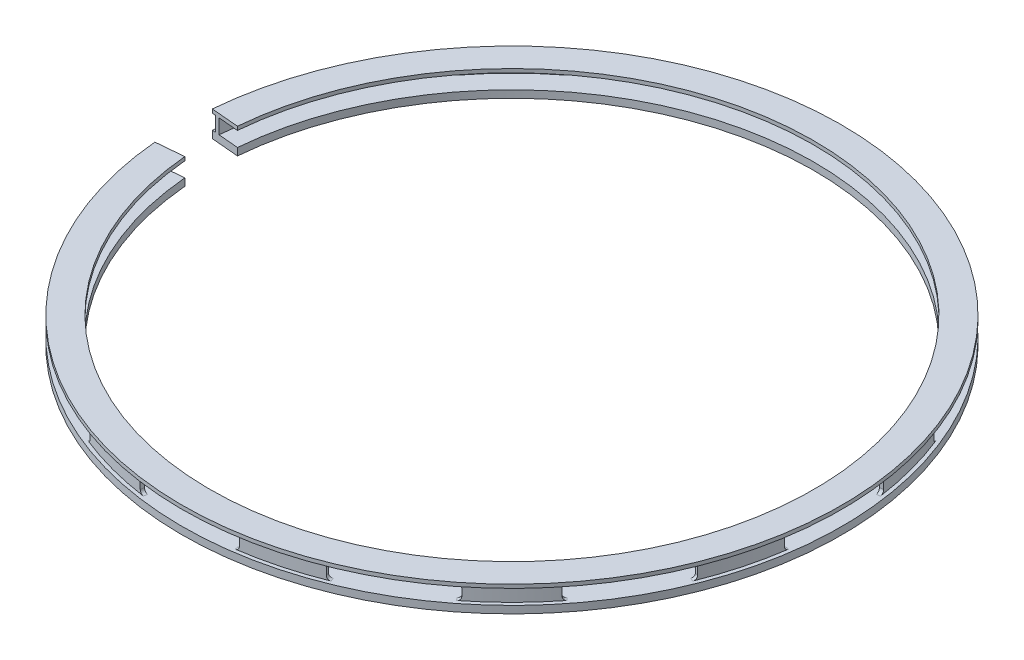
from build123d import *
from build123d.topology import SkipClean

# Parameters (mm, degrees)
REVOLVE2_ANGLE           = 350
SKETCH2_W                = 1
SKETCH2_H                = 2
CUT_REVOLVE1_ANGLE       = 17.5
FILLET1_R                = 0.5
CIRPATTERN2_COUNT        = 12
FILLET1_OF_CIRPATTERN2_R = 0.5


with BuildPart() as part:
    # Sketch1 → Revolve2 (revolve, symmetric)
    with SkipClean():  # the faces are left unmerged after this step: merging them gives an invalid solid
        with BuildSketch(Plane.XY) as revolve2_sk:
            Polygon((41, 0), (44.75, 0), (44.75, 1), (44.25, 1), (44.25, 3), (44.75, 3), (44.75, 3.5), (44.25, 3.5), (43.75, 3.5), (41, 3.5), (41, 3), (43.75, 3), (43.75, 1), (41, 1), align=None)
        revolve(axis=Axis((0, 0, 0), (0, 1, 0)), revolution_arc=REVOLVE2_ANGLE / 2)
        revolve(revolve2_sk.sketch, axis=Axis((0, 0, 0), (0, -1, 0)), revolution_arc=REVOLVE2_ANGLE / 2)
    add(part.part.scale(1), mode=Mode.REPLACE)  # the faces are merged on a copy

    # Sketch2 → Cut-Revolve1 (revolve, symmetric, cut)
    with BuildSketch(Plane.XY) as cut_revolve1_sk:
        with Locations((43.75, 2)):
            Rectangle(SKETCH2_W, SKETCH2_H)
    cut_revolve1 = revolve(axis=Axis((0, 0, 0), (0, 1, 0)), revolution_arc=CUT_REVOLVE1_ANGLE / 2, mode=Mode.SUBTRACT)
    cut_revolve1 = cut_revolve1 + revolve(cut_revolve1_sk.sketch, axis=Axis((0, 0, 0), (0, -1, 0)), revolution_arc=CUT_REVOLVE1_ANGLE / 2, mode=Mode.SUBTRACT)

    # Fillet1
    fillet1_edges = [part.edges().sort_by_distance(p)[0] for p in [
        (43.487906461, 3, 6.693428992),
        (43.487906461, 1, 6.693428992),
        (43.487906461, 3, -6.693428992),
        (43.487906461, 1, -6.693428992),
    ]]
    fillet(fillet1_edges, radius=FILLET1_R)

    # CirPattern2: Cut-Revolve1 ×12 about axis, 1 skipped
    cirpattern2_axis = Axis((0, 3.5, 0), (0, -1, 0))
    add([cut_revolve1.rotate(cirpattern2_axis, i * 360 / CIRPATTERN2_COUNT) for i in range(1, CIRPATTERN2_COUNT) if i not in (6,)], mode=Mode.SUBTRACT)

    # Fillet1 of CirPattern2
    fillet1_of_cirpattern2_edges = [part.edges().sort_by_distance(p)[0] for p in [
        (34.314917256, 3, 27.540632776),
        (34.314917256, 1, 27.540632776),
        (41.008346248, 3, 15.947273684),
        (41.008346248, 1, 15.947273684),
        (15.947273684, 3, 41.008346248),
        (15.947273684, 1, 41.008346248),
        (27.540632776, 3, 34.314917256),
        (27.540632776, 1, 34.314917256),
        (-6.693428992, 3, 43.487906461),
        (-6.693428992, 1, 43.487906461),
        (6.693428992, 3, 43.487906461),
        (6.693428992, 1, 43.487906461),
        (-27.540632776, 3, 34.314917256),
        (-27.540632776, 1, 34.314917256),
        (-15.947273684, 3, 41.008346248),
        (-15.947273684, 1, 41.008346248),
        (-41.008346248, 3, 15.947273684),
        (-41.008346248, 1, 15.947273684),
        (-34.314917256, 3, 27.540632776),
        (-34.314917256, 1, 27.540632776),
        (-34.314917256, 3, -27.540632776),
        (-34.314917256, 1, -27.540632776),
        (-41.008346248, 3, -15.947273684),
        (-41.008346248, 1, -15.947273684),
        (-15.947273684, 3, -41.008346248),
        (-15.947273684, 1, -41.008346248),
        (-27.540632776, 3, -34.314917256),
        (-27.540632776, 1, -34.314917256),
        (6.693428992, 3, -43.487906461),
        (6.693428992, 1, -43.487906461),
        (-6.693428992, 3, -43.487906461),
        (-6.693428992, 1, -43.487906461),
        (27.540632776, 3, -34.314917256),
        (27.540632776, 1, -34.314917256),
        (15.947273684, 3, -41.008346248),
        (15.947273684, 1, -41.008346248),
        (41.008346248, 3, -15.947273684),
        (41.008346248, 1, -15.947273684),
        (34.314917256, 3, -27.540632776),
        (34.314917256, 1, -27.540632776),
    ]]
    fillet(fillet1_of_cirpattern2_edges, radius=FILLET1_OF_CIRPATTERN2_R)


solid = part.part
